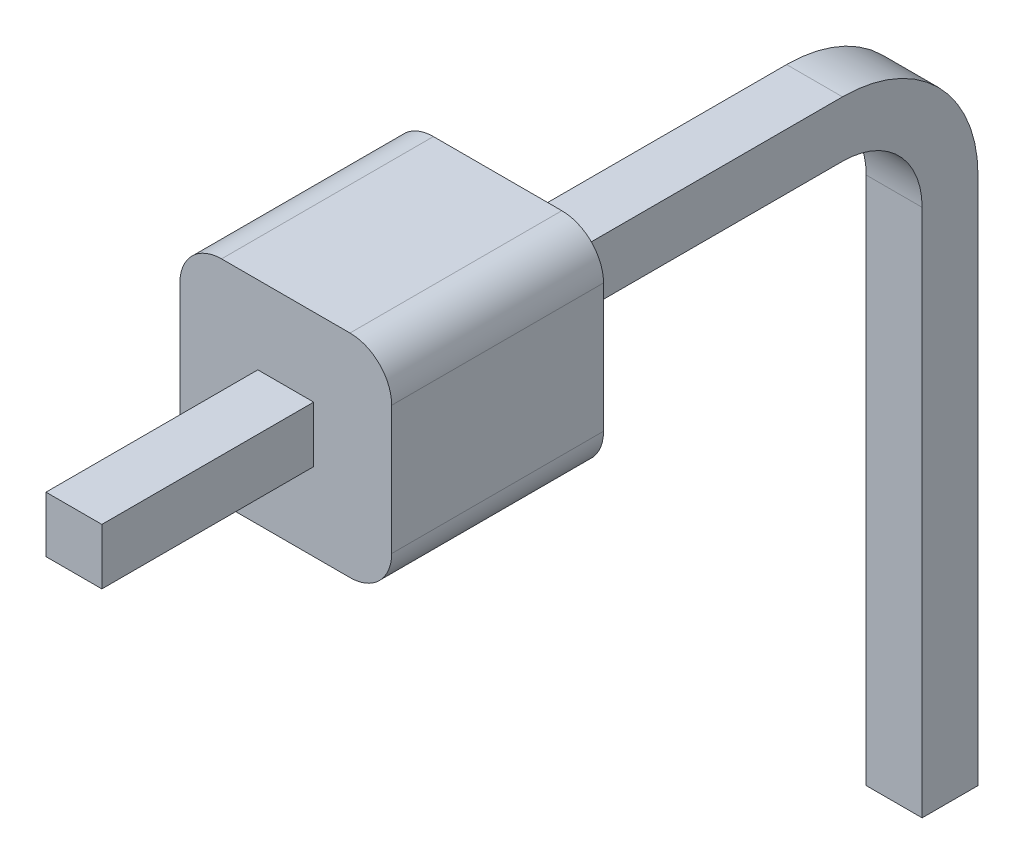
from build123d import *

# Parameters (mm, degrees)
SKETCH_1_W      = 2.54
SKETCH_1_H      = 2.54
EXTRUDE_1_DEPTH = 2.54
SKETCH_2_W      = 0.67
SKETCH_2_H      = 0.67
FILLET_1_R      = 0.5


with BuildPart() as part:
    # 草图1 → 拉伸1 (new body)
    with BuildSketch(Plane.XY):
        with Locations((0, -1.289090726)):
            Rectangle(SKETCH_1_W, SKETCH_1_H)
    extrude(amount=EXTRUDE_1_DEPTH)

    # 扫描1: sweep along a path in 草图3
    with BuildLine(Plane(origin=(0, 0, 0), x_dir=(0, 0, -1), z_dir=(1, 0, 0))) as sweep_1_path:
        Line((-5.08, -1.299090726), (3.8, -1.299090726))
        ThreePointArc((3.8, -1.299090726), (4.70509668, -1.673994046), (5.08, -2.579090726))
        Line((5.08, -2.579090726), (5.08, -8.919090726))
    # 草图2 → 扫描1 (sweep)
    with BuildSketch(Plane(origin=(0, 0, 5.08), x_dir=(-1, 0, 0), z_dir=(0, 0, -1))):
        with Locations((0, -1.289090726)):
            Rectangle(SKETCH_2_W, SKETCH_2_H)
    sweep(path=sweep_1_path.line)

    # 圆角1
    fillet_1_edges = [part.edges().sort_by_distance(p)[0] for p in [
        (1.27, -0.019090726, 1.27),
        (1.27, -2.559090726, 1.27),
        (-1.27, -2.559090726, 1.27),
        (-1.27, -0.019090726, 1.27),
    ]]
    fillet(fillet_1_edges, radius=FILLET_1_R)


solid = part.part
